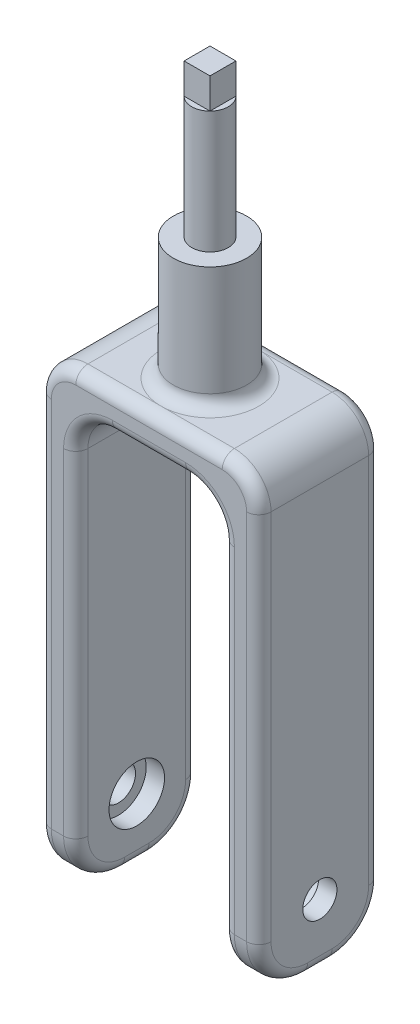
from build123d import *

# Parameters (mm, degrees)
SKETCH_1_W           = 36
SKETCH_1_H           = 20
EXTRUDE_1_DEPTH      = 75
SKETCH_2_R           = 6
EXTRUDE_2_DEPTH      = 20
SKETCH_7_R           = 3
EXTRUDE_3_DEPTH      = 25
SKETCH_8_OUTSIDE_W   = 63.374
SKETCH_8_OUTSIDE_H   = 47.374
SKETCH_8_OUTSIDE_W_2 = 4.242640688
SKETCH_8_OUTSIDE_H_2 = 4.242640688
CUT_EXTRUDE_6_DEPTH  = 5
SKETCH_3_W           = 24
SKETCH_3_H           = 69
CUT_EXTRUDE_1_DEPTH  = 80.680612447
FILLET_1_R           = 6
FILLET_4_R           = 2
FILLET_3_R           = 8
FILLET_2_R           = 2
SKETCH_4_R           = 2.8
CUT_EXTRUDE_2_DEPTH  = 84.791407674
SKETCH_6_R           = 4.55
CUT_EXTRUDE_4_DEPTH  = 3


with BuildPart() as part:
    # 草图1 → 凸台-拉伸1 (new body)
    with BuildSketch(Plane(origin=(0, 0, 0), x_dir=(1, 0, 0), z_dir=(0, 1, 0))):
        Rectangle(SKETCH_1_W, SKETCH_1_H)
    extrude(amount=-EXTRUDE_1_DEPTH)

    # 草图2 → 凸台-拉伸2 (add)
    with BuildSketch(Plane(origin=(0, 0, 0), x_dir=(1, 0, 0), z_dir=(0, 1, 0))):
        with Locations(Location((0, 0, 0), (0, 0, 270))):
            Circle(SKETCH_2_R)
    extrude(amount=EXTRUDE_2_DEPTH)

    # 草图7 → 凸台-拉伸3 (add)
    with BuildSketch(Plane(origin=(0, 20, 0), x_dir=(1, 0, 0), z_dir=(0, 1, 0))):
        with Locations(Location((0, 0, 0), (0, 0, 270))):
            Circle(SKETCH_7_R)
    extrude(amount=EXTRUDE_3_DEPTH)

    # 草图8 outside → 切除-拉伸6 (cut)
    with BuildSketch(Plane(origin=(0, 45, 0), x_dir=(1, 0, 0), z_dir=(0, 1, 0))):
        Rectangle(SKETCH_8_OUTSIDE_W, SKETCH_8_OUTSIDE_H)
        Rectangle(SKETCH_8_OUTSIDE_W_2, SKETCH_8_OUTSIDE_H_2, mode=Mode.SUBTRACT)
    extrude(amount=-CUT_EXTRUDE_6_DEPTH, mode=Mode.SUBTRACT)

    # 草图3 → 切除-拉伸1 (cut, through all)
    with BuildSketch(Plane.XY.offset(10)):
        with Locations((0, -40.5)):
            Rectangle(SKETCH_3_W, SKETCH_3_H)
    extrude(amount=-CUT_EXTRUDE_1_DEPTH, mode=Mode.SUBTRACT)

    # 圆角1
    fillet_1_edges = [part.edges().sort_by_distance(p)[0] for p in [
        (18, 0, 0),
        (-18, 0, 0),
        (-12, -6, 0),
        (12, -6, 0),
    ]]
    fillet(fillet_1_edges, radius=FILLET_1_R)

    # 圆角4
    fillet_4_edges = [part.edges().sort_by_distance(p)[0] for p in [
        (0, 0, -6),
    ]]
    fillet(fillet_4_edges, radius=FILLET_4_R)

    # 圆角3
    fillet_3_edges = [part.edges().sort_by_distance(p)[0] for p in [
        (15, -75, -10),
        (-15, -75, -10),
        (15, -75, 10),
        (-15, -75, 10),
    ]]
    fillet(fillet_3_edges, radius=FILLET_3_R)

    # 圆角2
    fillet_2_edges = [part.edges().sort_by_distance(p)[0] for p in [
        (12, -72.656854249, 7.656854249),
        (12, -72.656854249, -7.656854249),
        (18, -75, 0),
        (18, -36.5, 10),
        (18, -72.656854249, 7.656854249),
        (18, -72.656854249, -7.656854249),
        (-18, -36.5, 10),
        (-18, -75, 0),
        (-18, -72.656854249, 7.656854249),
        (-18, -72.656854249, -7.656854249),
        (-12, -75, 0),
        (-12, -72.656854249, 7.656854249),
        (-12, -72.656854249, -7.656854249),
        (0, 0, 10),
        (0, 0, -10),
        (-12, -39.5, 10),
        (0, -6, 10),
        (16.242640687, -1.757359313, 10),
        (-16.242640687, -1.757359313, 10),
        (-12, -39.5, -10),
        (0, -6, -10),
        (16.242640687, -1.757359313, -10),
        (-16.242640687, -1.757359313, -10),
        (10.242640687, -7.757359313, 10),
        (10.242640687, -7.757359313, -10),
        (-10.242640687, -7.757359313, 10),
        (-10.242640687, -7.757359313, -10),
        (-18, -36.5, -10),
        (18, -36.5, -10),
        (12, -39.5, -10),
        (12, -39.5, 10),
        (12, -75, 0),
    ]]
    fillet(fillet_2_edges, radius=FILLET_2_R - 0.0001)  # a hair under: the kernel refuses the full size

    # 草图4 → 切除-拉伸2 (cut, through all)
    with BuildSketch(Plane(origin=(18, 0, 0), x_dir=(0, 0, -1), z_dir=(1, 0, 0))):
        with Locations((0, -65)):
            Circle(SKETCH_4_R)
    extrude(amount=-CUT_EXTRUDE_2_DEPTH, mode=Mode.SUBTRACT)

    # 草图6 → 切除-拉伸4 (cut)
    with BuildSketch(Plane(origin=(12, 0, 0), x_dir=(0, 0, -1), z_dir=(1, 0, 0))):
        with Locations((0, -65)):
            Circle(SKETCH_6_R)
    cut_extrude_4 = extrude(amount=CUT_EXTRUDE_4_DEPTH, mode=Mode.SUBTRACT)

    # 镜向1: 切除-拉伸4 across plane
    add(cut_extrude_4.mirror(Plane(origin=(0, 0, 0), x_dir=(0, 0, 1), z_dir=(1, 0, 0))), mode=Mode.SUBTRACT)


solid = part.part
